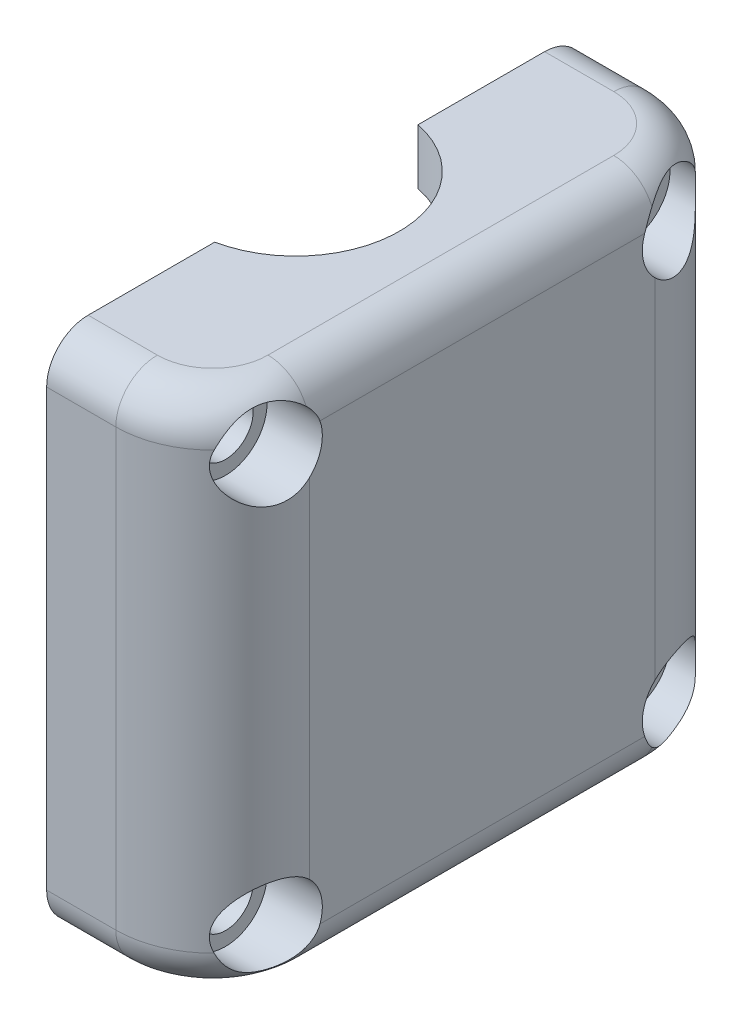
from build123d import *

# Parameters (mm, degrees)
BOSS_EXTRU_1_DEPTH      = 37.5
BOSS_EXTRU_2_DEPTH      = 4
ESQUISSE3_R             = 2
ENL_V_MAT_EXTRU_1_DEPTH = 56.418859606
ESQUISSE5_R             = 3
ENL_V_MAT_EXTRU_2_DEPTH = 4
CONG_1_R                = 7
CONG_2_R                = 3


with BuildPart() as part:
    # Esquisse1 → Boss.-Extru.1 (new body)
    with BuildSketch(Plane(origin=(0, 0, 0), x_dir=(1, 0, 0), z_dir=(0, 1, 0))):
        with BuildLine():
            Line((0, 29.133924434), (0, 39))
            Line((0, 39), (12, 39))
            Line((12, 39), (12, 0))
            Line((12, 0), (0, 0))
            Line((0, 0), (0, 9.866075566))
            ThreePointArc((0, 9.866075566), (8.25, 19.5), (0, 29.133924434))
        make_face()
    extrude(amount=BOSS_EXTRU_1_DEPTH)

    # Esquisse2 → Boss.-Extru.2 (add)
    with BuildSketch(Plane.XZ):
        with BuildLine():
            Line((0, 0), (12, 0))
            Line((12, 0), (12, -39))
            Line((12, -39), (0, -39))
            Line((0, -39), (0, -26.848469228))
            ThreePointArc((0, -26.848469228), (6, -19.5), (0, -12.151530772))
            Line((0, -12.151530772), (0, 0))
        make_face()
    boss_extru_2 = extrude(amount=-BOSS_EXTRU_2_DEPTH)

    # Symétrie1: Boss.-Extru.2 across plane
    add(boss_extru_2.mirror(Plane.ZX.offset(18.75)))

    # Esquisse3 → Enlèv. mat.-Extru.1 (cut, through all)
    with BuildSketch(Plane.ZY):
        with Locations((-34.066962217, 33.5)):
            Circle(ESQUISSE3_R)
        with Locations(Location((-34.066962217, 4, 0), (0, 0, 180))):
            Circle(ESQUISSE3_R)
        with Locations((-4.933037783, 4)):
            Circle(ESQUISSE3_R)
        with Locations(Location((-4.933037783, 33.5, 0), (0, 0, 180))):
            Circle(ESQUISSE3_R)
    extrude(amount=-ENL_V_MAT_EXTRU_1_DEPTH, mode=Mode.SUBTRACT)

    # Esquisse5 → Enlèv. mat.-Extru.2 (cut)
    with BuildSketch(Plane(origin=(12, 0, 0), x_dir=(0, 0, -1), z_dir=(1, 0, 0))):
        with Locations((4.933037783, 33.5)):
            Circle(ESQUISSE5_R)
        with Locations((34.066962217, 33.5)):
            Circle(ESQUISSE5_R)
        with Locations((34.066962217, 4)):
            Circle(ESQUISSE5_R)
        with Locations((4.933037783, 4)):
            Circle(ESQUISSE5_R)
    extrude(amount=-ENL_V_MAT_EXTRU_2_DEPTH, mode=Mode.SUBTRACT)

    # Congé1
    # the kernel refuses this fillet: 7 mm, written as the material it takes off along each edge
    with BuildSketch(Plane(origin=(12, 55, -39), x_dir=(-1, 0, 0), z_dir=(0, -1, 0)), Plane(origin=(12, 55, 0), x_dir=(0, 0, -1), z_dir=(0, -1, 0))) as cong_1_piece_1:
        with BuildLine():
            CenterArc((CONG_1_R, -CONG_1_R), CONG_1_R, 90, 90)
            Line((0, -CONG_1_R), (0, 0))
            Line((0, 0), (CONG_1_R, 0))
        make_face()
    extrude(amount=72.5, mode=Mode.SUBTRACT)

    # Congé2
    # the kernel refuses this fillet: 3 mm, written as the material it takes off along each edge
    with BuildSketch(Plane(origin=(5, 0, 0), x_dir=(0, 0, -1), z_dir=(-1, 0, 0)), Plane(origin=(-7.5, 0, -39), x_dir=(0, 0, 1), z_dir=(1, 0, 0)), Plane(origin=(-7.5, 37.5, -39), x_dir=(0, -1, 0), z_dir=(1, 0, 0))) as cong_2_piece_1:
        with BuildLine():
            CenterArc((CONG_2_R, -CONG_2_R), CONG_2_R, 90, 90)
            Line((0, -CONG_2_R), (0, 0))
            Line((0, 0), (CONG_2_R, 0))
        make_face()
    extrude(amount=12.5, mode=Mode.SUBTRACT)
    with BuildSketch(Plane(origin=(5, 0, -7), x_dir=(0, 0, 1), z_dir=(-1, 0, 0))) as cong_2_piece_2:
        with BuildLine():
            CenterArc((7 - CONG_2_R, CONG_2_R), CONG_2_R, 270, 90)
            Line((7, CONG_2_R), (7, 0))
            Line((7, 0), (7 - CONG_2_R, 0))
        make_face()
    revolve(axis=Axis((5, 0, -7), (0, 1, 0)), revolution_arc=90, mode=Mode.SUBTRACT)
    with BuildSketch(Plane(origin=(5, 0, -32), x_dir=(1, 0, 0), z_dir=(0, 0, 1))) as cong_2_piece_3:
        with BuildLine():
            CenterArc((7 - CONG_2_R, CONG_2_R), CONG_2_R, 270, 90)
            Line((7, CONG_2_R), (7, 0))
            Line((7, 0), (7 - CONG_2_R, 0))
        make_face()
    revolve(axis=Axis((5, 0, -32), (0, 1, 0)), revolution_arc=90, mode=Mode.SUBTRACT)
    with BuildSketch(Plane(origin=(5, 37.5, 0), x_dir=(0, 0, -1), z_dir=(-1, 0, 0))) as cong_2_piece_4:
        with BuildLine():
            CenterArc((CONG_2_R, CONG_2_R), CONG_2_R, 180, 90)
            Line((0, CONG_2_R), (0, 0))
            Line((0, 0), (CONG_2_R, 0))
        make_face()
    extrude(amount=12.5, mode=Mode.SUBTRACT)
    with BuildSketch(Plane(origin=(5, 37.5, -7), x_dir=(0, 0, 1), z_dir=(-1, 0, 0))) as cong_2_piece_5:
        with BuildLine():
            CenterArc((7 - CONG_2_R, -CONG_2_R), CONG_2_R, 0, 90)
            Line((7, -CONG_2_R), (7, 0))
            Line((7, 0), (7 - CONG_2_R, 0))
        make_face()
    revolve(axis=Axis((5, 37.5, -7), (0, 1, 0)), revolution_arc=90, mode=Mode.SUBTRACT)
    with BuildSketch(Plane(origin=(5, 37.5, -32), x_dir=(1, 0, 0), z_dir=(0, 0, 1))) as cong_2_piece_6:
        with BuildLine():
            CenterArc((7 - CONG_2_R, -CONG_2_R), CONG_2_R, 0, 90)
            Line((7, -CONG_2_R), (7, 0))
            Line((7, 0), (7 - CONG_2_R, 0))
        make_face()
    revolve(axis=Axis((5, 37.5, -32), (0, 1, 0)), revolution_arc=90, mode=Mode.SUBTRACT)
    with BuildSketch(Plane(origin=(12, 0, -32), x_dir=(-1, 0, 0), z_dir=(0, 0, 1))) as cong_2_piece_7:
        with BuildLine():
            CenterArc((CONG_2_R, -CONG_2_R), CONG_2_R, 90, 90)
            Line((0, -CONG_2_R), (0, 0))
            Line((0, 0), (CONG_2_R, 0))
        make_face()
    extrude(amount=25, mode=Mode.SUBTRACT)
    with BuildSketch(Plane(origin=(12, 37.5, -32), x_dir=(-1, 0, 0), z_dir=(0, 0, 1))) as cong_2_piece_8:
        with BuildLine():
            CenterArc((CONG_2_R, CONG_2_R), CONG_2_R, 180, 90)
            Line((0, CONG_2_R), (0, 0))
            Line((0, 0), (CONG_2_R, 0))
        make_face()
    extrude(amount=25, mode=Mode.SUBTRACT)


solid = part.part
